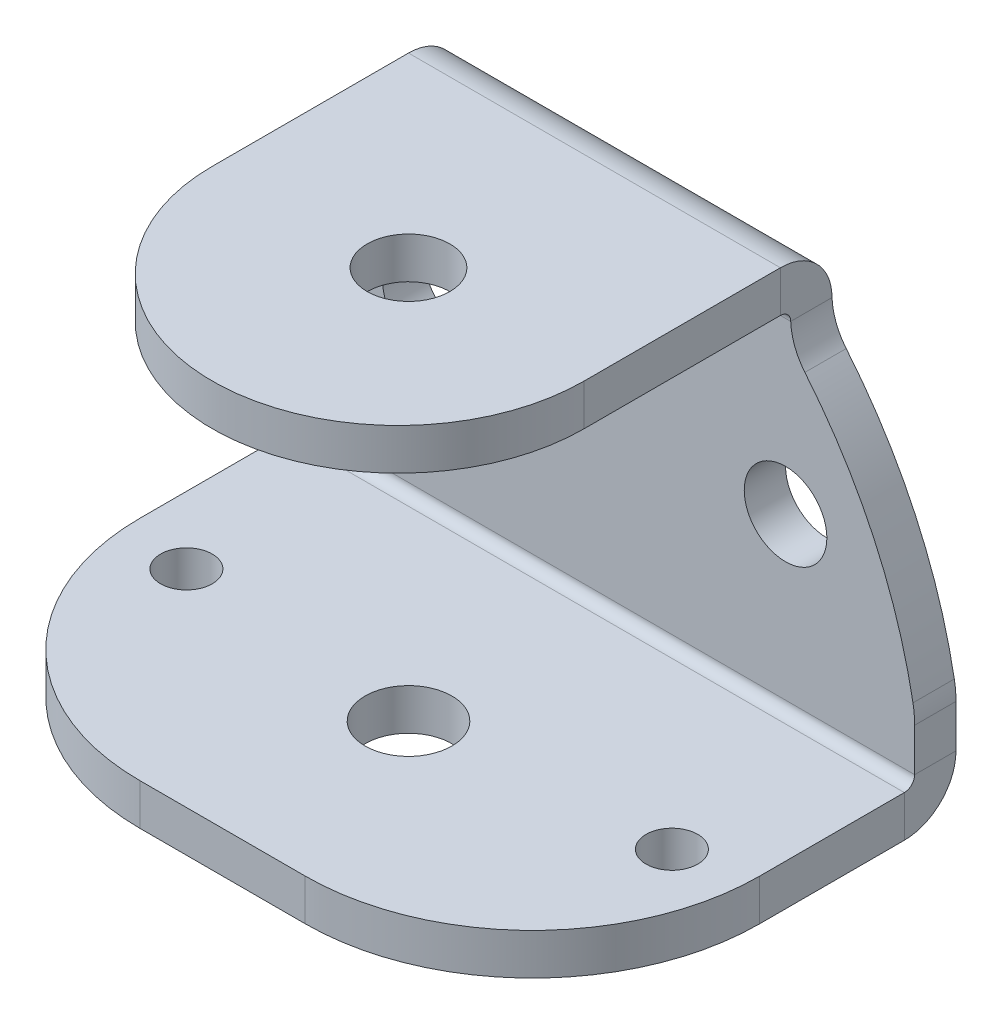
from build123d import *

# Parameters (mm, degrees)
BRIDA_BASE1_DEPTH                = 2
REDONDEO5MM_R                    = 5
REDONDEO3MM_R                    = 3
BRIDA_DE_ARISTA1_STRIP_W         = 9
BRIDA_DE_ARISTA1_STRIP_H         = 2
BRIDA_DE_ARISTA1_STRIP_CUT_DEPTH = 30
BRIDA_DE_ARISTA1_DEPTH           = 30
BRIDA_DE_ARISTA2_DEPTH           = 18
BRIDA_START                      = 2
BRIDA_DE_ARISTA2_FLAT_DEPTH      = 2
CORTAR_EXTRUIR6_REACH            = 43.255
CROQUIS26_R                      = 2
REDONDEO11MM_R                   = 11
TALADRO_ROSCADO_M32_D            = 2.5
TALADRO_ROSCADO_M32_DEPTH        = 20.65
TALADRO_ROSCADO_M32_TIP          = 0.751075774
TALADRO_ROSCADO_M52_D            = 4.2
TALADRO_ROSCADO_M52_DEPTH        = 2
CORTAR_EXTRUIR7_REACH            = 42.274
CROQUIS36_R                      = 2


# Sheet-metal steps are written as plain solids
with BuildPart() as part:
    # Croquis1 → Brida base1 (new body)
    with BuildSketch(Plane.XY):
        with BuildLine():
            Line((0, 0), (30, 0))
            Line((30, 0), (30, 3))
            ThreePointArc((30, 3), (27.901523057, 9.682731068), (24, 15.5))
            Line((24, 15.5), (24, 16.5))
            Line((24, 16.5), (6, 16.5))
            Line((6, 16.5), (6, 15.5))
            ThreePointArc((6, 15.5), (2.098476943, 9.682731068), (0, 3))
            Line((0, 3), (0, 0))
        make_face()
    extrude(amount=-BRIDA_BASE1_DEPTH)

    # Redondeo5mm
    redondeo5mm_edges = [part.edges().sort_by_distance(p)[0] for p in [
        (0, 3, -1),
        (30, 3, -1),
    ]]
    fillet(redondeo5mm_edges, radius=REDONDEO5MM_R)

    # Redondeo3mm
    # the kernel refuses this fillet: 3 mm, written as the material it adds along each edge
    with BuildSketch(Plane(origin=(24, 15.5, 0), x_dir=(0, 1, 0), z_dir=(0, 0, -1))) as redondeo3mm_piece_1:
        with BuildLine():
            CenterArc((1.118262022, 2.997668109), REDONDEO3MM_R, 230.394906527, 37.345869832)
            Line((-0.794215431, 0.686298387), (-0.83246498, 0.640070993))
            ThreePointArc((-0.83246498, 0.640070993), (-0.432666371, 0.301999114), (-0.040192089, -0.044548805))
            Line((-0.040192089, -0.044548805), (0, -0.06))
            ThreePointArc((0, -0.06), (0.5, -0.06), (0.99763476, -0.059953362))
            Line((0.99763476, -0.059953362), (1, 0))
        make_face()
    extrude(amount=2)
    with BuildSketch(Plane(origin=(6, 15.5, 0), x_dir=(-0.6538299662985165, -0.75664151034032, 0), z_dir=(0, 0, -1))) as redondeo3mm_piece_2:
        with BuildLine():
            CenterArc((1.113841774, 2.999313346), REDONDEO3MM_R, 231.428232408, 37.345869832)
            Line((-0.75664151, 0.653829966), (-0.794051176, 0.606920299))
            ThreePointArc((-0.794051176, 0.606920299), (-0.417550553, 0.281516493), (-0.039229798, -0.045398491))
            Line((-0.039229798, -0.045398491), (0.001283659, -0.059986267))
            ThreePointArc((0.001283659, -0.059986267), (0.524829407, -0.054385173), (1.048375155, -0.059986267))
            Line((1.048375155, -0.059986267), (1.049658814, 0))
        make_face()
    extrude(amount=2)

    # Brida de arista1 strip (across the edge) → Brida de arista1 strip cut (cut)
    with BuildSketch(Plane.YZ):
        with Locations((-4, -1)):
            Rectangle(BRIDA_DE_ARISTA1_STRIP_W, BRIDA_DE_ARISTA1_STRIP_H)
    extrude(amount=BRIDA_DE_ARISTA1_STRIP_CUT_DEPTH, mode=Mode.SUBTRACT)

    # Brida de arista1 section (across the edge) → Brida de arista1 (add)
    with BuildSketch(Plane.YZ):
        with BuildLine():
            Line((-2, 0.5), (-2, 18.5))
            Line((-2, 18.5), (0, 18.5))
            Line((0, 18.5), (0, 0.5))
            ThreePointArc((0, 0.5), (0.146446609, 0.146446609), (0.5, 0))
            Line((0.5, 0), (0.5, -2))
            ThreePointArc((0.5, -2), (-1.267766953, -1.267766953), (-2, 0.5))
        make_face()
    extrude(amount=BRIDA_DE_ARISTA1_DEPTH)

    # Brida de arista2 bend section (across the edge) → Brida de arista2 (add)
    with BuildSketch(Plane(origin=(24, 17, 0), x_dir=(0, -1, 0), z_dir=(-1, 0, 0))):
        with BuildLine():
            Line((-2, 0.5), (0, 0.5))
            ThreePointArc((0, 0.5), (0.146446609, 0.146446609), (0.5, 0))
            Line((0.5, 0), (0.5, -2))
            ThreePointArc((0.5, -2), (-1.267766953, -1.267766953), (-2, 0.5))
        make_face()
    extrude(amount=BRIDA_DE_ARISTA2_DEPTH)

    # Brida de arista2 profile (on flange) → Brida de arista2 flat (add)
    with BuildSketch(Plane(origin=(0, 17, 0), x_dir=(-1, 0, 0), z_dir=(0, 1, 0)).offset(BRIDA_START)):
        with BuildLine():
            ThreePointArc((-6, 10), (-15, 19), (-24, 10))
            Line((-24, 10), (-24, 0.5))
            Line((-24, 0.5), (-6, 0.5))
            Line((-6, 0.5), (-6, 10))
        make_face()
    extrude(amount=-BRIDA_DE_ARISTA2_FLAT_DEPTH)

    # Croquis26 → Cortar-Extruir6 (cut, up to next)
    with BuildSketch(Plane(origin=(0, 0, -2), x_dir=(-1, 0, 0), z_dir=(0, 0, -1)), mode=Mode.PRIVATE) as cortar_extruir6_sk1:
        with Locations((-6.25, 8.3)):
            Circle(CROQUIS26_R)
    cortar_extruir6_tool1 = extrude(cortar_extruir6_sk1.sketch, amount=-CORTAR_EXTRUIR6_REACH, mode=Mode.PRIVATE) & part.part
    # Croquis26 → Cortar-Extruir6 (cut, up to next)
    with BuildSketch(Plane(origin=(0, 0, -2), x_dir=(-1, 0, 0), z_dir=(0, 0, -1)), mode=Mode.PRIVATE) as cortar_extruir6_sk2:
        with Locations((-23.75, 8.3)):
            Circle(CROQUIS26_R)
    cortar_extruir6_tool2 = extrude(cortar_extruir6_sk2.sketch, amount=-CORTAR_EXTRUIR6_REACH, mode=Mode.PRIVATE) & part.part
    add(cortar_extruir6_tool1.solids().sort_by_distance((6.25, 8.3, -2))[0], mode=Mode.SUBTRACT)
    add(cortar_extruir6_tool2.solids().sort_by_distance((23.75, 8.3, -2))[0], mode=Mode.SUBTRACT)

    # Redondeo11mm
    redondeo11mm_edges = [part.edges().sort_by_distance(p)[0] for p in [
        (0, -1, 18.5),
        (30, -1, 18.5),
    ]]
    fillet(redondeo11mm_edges, radius=REDONDEO11MM_R)

    # Taladro roscado M32
    with Locations(Plane(origin=(0, 0, 0), x_dir=(1, 0, 0), z_dir=(0, 1, 0))):
        with Locations((3.25, -8.5), (26.75, -8.5)):
            Hole(TALADRO_ROSCADO_M32_D / 2, depth=TALADRO_ROSCADO_M32_DEPTH)
            with Locations((0, 0, -(TALADRO_ROSCADO_M32_DEPTH + TALADRO_ROSCADO_M32_TIP / 2))):  # 118° drill point
                Cone(0, TALADRO_ROSCADO_M32_D / 2, TALADRO_ROSCADO_M32_TIP, mode=Mode.SUBTRACT)

    # Taladro roscado M52
    with Locations(Plane(origin=(3.715500562, 0, 2.638137214), x_dir=(1, 0, 0), z_dir=(0, 1, 0))):
        with Locations((11.284499438, -6.861862786)):
            Hole(TALADRO_ROSCADO_M52_D / 2, depth=TALADRO_ROSCADO_M52_DEPTH)

    # Croquis36 → Cortar-Extruir7 (cut, up to next)
    with BuildSketch(Plane(origin=(0, 17, 0), x_dir=(1, 0, 0), z_dir=(0, 1, 0)), mode=Mode.PRIVATE) as cortar_extruir7_sk1:
        with Locations(Location((15, -9.5, 0), (0, 0, 270))):
            Circle(CROQUIS36_R)
    cortar_extruir7_tool1 = extrude(cortar_extruir7_sk1.sketch, amount=CORTAR_EXTRUIR7_REACH, mode=Mode.PRIVATE) & part.part
    add(cortar_extruir7_tool1.solids().sort_by_distance((15, 17, 9.5))[0], mode=Mode.SUBTRACT)


solid = part.part
